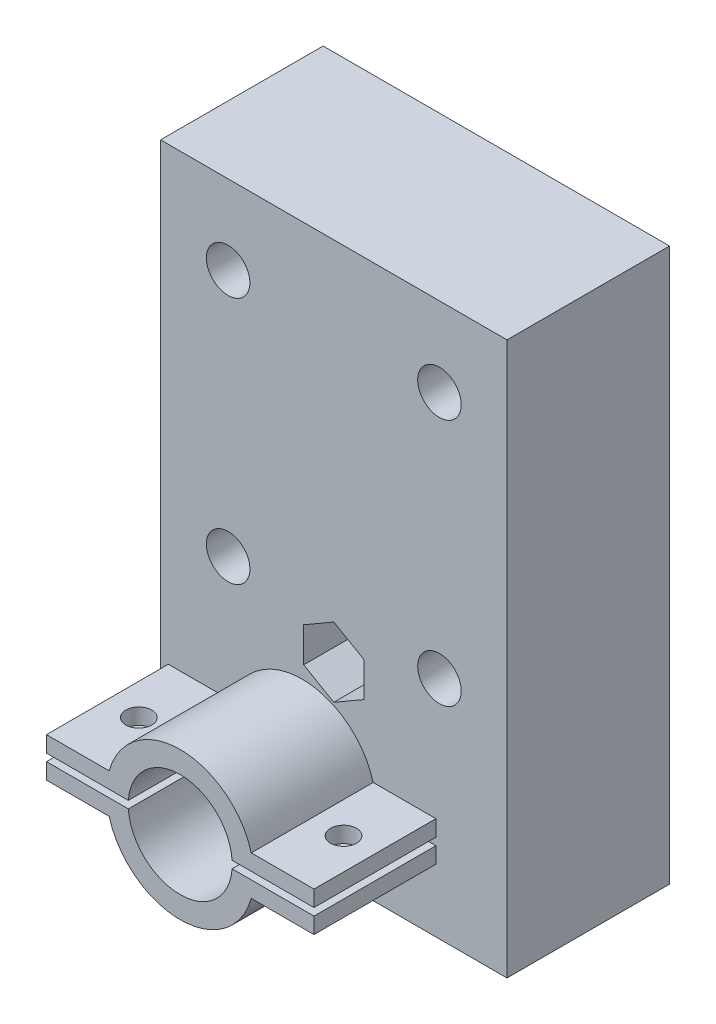
from build123d import *

# Parameters (mm, degrees)
SKETCH1_W           = 42.62295082
SKETCH1_H           = 50
SKETCH1_R           = 2.677018134
BOSS_EXTRUDE1_DEPTH = 20
SKETCH2_R           = 8.73
CUT_EXTRUDE2_DEPTH  = 7.94
SKETCH3_R           = 2.2
CUT_EXTRUDE3_DEPTH  = 10
CUT_EXTRUDE4_START  = -7
CUT_EXTRUDE4_DEPTH  = 32.460095998
SKETCH7_W           = 42.62295082
SKETCH7_H           = 20
BOSS_EXTRUDE2_DEPTH = 18
SKETCH6_R           = 6.4
CUT_EXTRUDE5_DEPTH  = 52.992105017
BOSS_EXTRUDE5_DEPTH = 15
SKETCH10_R          = 1.6
CUT_EXTRUDE8_DEPTH  = 80.392562524


with BuildPart() as part:
    # Sketch1 → Boss-Extrude1 (new body)
    with BuildSketch(Plane.XY):
        Rectangle(SKETCH1_W, SKETCH1_H)
        with Locations((-13, -15.25)):
            Circle(SKETCH1_R, mode=Mode.SUBTRACT)
        with Locations((13, -15.25)):
            Circle(SKETCH1_R, mode=Mode.SUBTRACT)
        with Locations((13, 15.25)):
            Circle(SKETCH1_R, mode=Mode.SUBTRACT)
        with Locations((-13, 15.25)):
            Circle(SKETCH1_R, mode=Mode.SUBTRACT)
    extrude(amount=BOSS_EXTRUDE1_DEPTH)

    # Sketch2 → Cut-Extrude2 (cut)
    with BuildSketch(Plane.XY):
        Circle(SKETCH2_R)
    extrude(amount=CUT_EXTRUDE2_DEPTH, mode=Mode.SUBTRACT)

    # Sketch3 → Cut-Extrude3 (cut)
    with BuildSketch(Plane(origin=(0, 0, 0), x_dir=(-1, 0, 0), z_dir=(0, 0, -1))):
        with Locations((0, -20)):
            Circle(SKETCH3_R)
    extrude(amount=-CUT_EXTRUDE3_DEPTH, mode=Mode.SUBTRACT)

    # Sketch5 → Cut-Extrude4 (cut, through all)
    with BuildSketch(Plane(origin=(0, 0, 0), x_dir=(-1, 0, 0), z_dir=(0, 0, -1)).offset(CUT_EXTRUDE4_START)):
        Polygon((0, -15.727608008), (-3.7, -17.863804004), (-3.7, -22.136195996), (0, -24.272391992), (3.7, -22.136195996), (3.7, -17.863804004), align=None)
    extrude(amount=-CUT_EXTRUDE4_DEPTH, mode=Mode.SUBTRACT)

    # Sketch7 → Boss-Extrude2 (add)
    with BuildSketch(Plane.XZ.offset(25)):
        with Locations((0, 10)):
            Rectangle(SKETCH7_W, SKETCH7_H)
    extrude(amount=BOSS_EXTRUDE2_DEPTH)

    # Sketch6 → Cut-Extrude5 (cut, through all)
    with BuildSketch(Plane(origin=(0, 0, 0), x_dir=(-1, 0, 0), z_dir=(0, 0, -1))):
        with Locations((3.896856088, -32.824049036)):
            Circle(SKETCH6_R)
    extrude(amount=-CUT_EXTRUDE5_DEPTH, mode=Mode.SUBTRACT)

    # Sketch8 → Boss-Extrude5 (add)
    with BuildSketch(Plane.XY.offset(20)):
        with BuildLine():
            ThreePointArc((-10.280677785, -32.369273769), (-3.896856088, -26.424049036), (2.486965609, -32.369273769))
            Line((2.486965609, -32.369273769), (12.561469986, -32.369273769))
            Line((12.561469986, -32.369273769), (12.561469986, -30.399273769))
            Line((12.561469986, -30.399273769), (4.845882313, -30.399273769))
            ThreePointArc((4.845882313, -30.399273769), (-3.896856088, -23.751287061), (-12.63959449, -30.399273769))
            Line((-12.63959449, -30.399273769), (-20.355182162, -30.399273769))
            Line((-20.355182162, -30.399273769), (-20.355182162, -32.369273769))
            Line((-20.355182162, -32.369273769), (-10.280677785, -32.369273769))
        make_face()
        with BuildLine():
            Line((-10.280677785, -33.278824303), (-20.355182162, -33.278824303))
            Line((-20.355182162, -33.278824303), (-20.355182162, -35.248824303))
            Line((-20.355182162, -35.248824303), (-12.63959449, -35.248824303))
            ThreePointArc((-12.63959449, -35.248824303), (-3.896856088, -41.896811011), (4.845882313, -35.248824303))
            Line((4.845882313, -35.248824303), (12.561469986, -35.248824303))
            Line((12.561469986, -35.248824303), (12.561469986, -33.278824303))
            Line((12.561469986, -33.278824303), (2.486965609, -33.278824303))
            ThreePointArc((2.486965609, -33.278824303), (-3.896856088, -39.224049036), (-10.280677785, -33.278824303))
        make_face()
    extrude(amount=BOSS_EXTRUDE5_DEPTH)

    # Sketch10 → Cut-Extrude8 (cut, through all)
    with BuildSketch(Plane.XZ.offset(43)):
        with Locations((-16.495182162, 27.5)):
            Circle(SKETCH10_R)
        with Locations((8.701469986, 27.5)):
            Circle(SKETCH10_R)
    extrude(amount=-CUT_EXTRUDE8_DEPTH, mode=Mode.SUBTRACT)


solid = part.part
